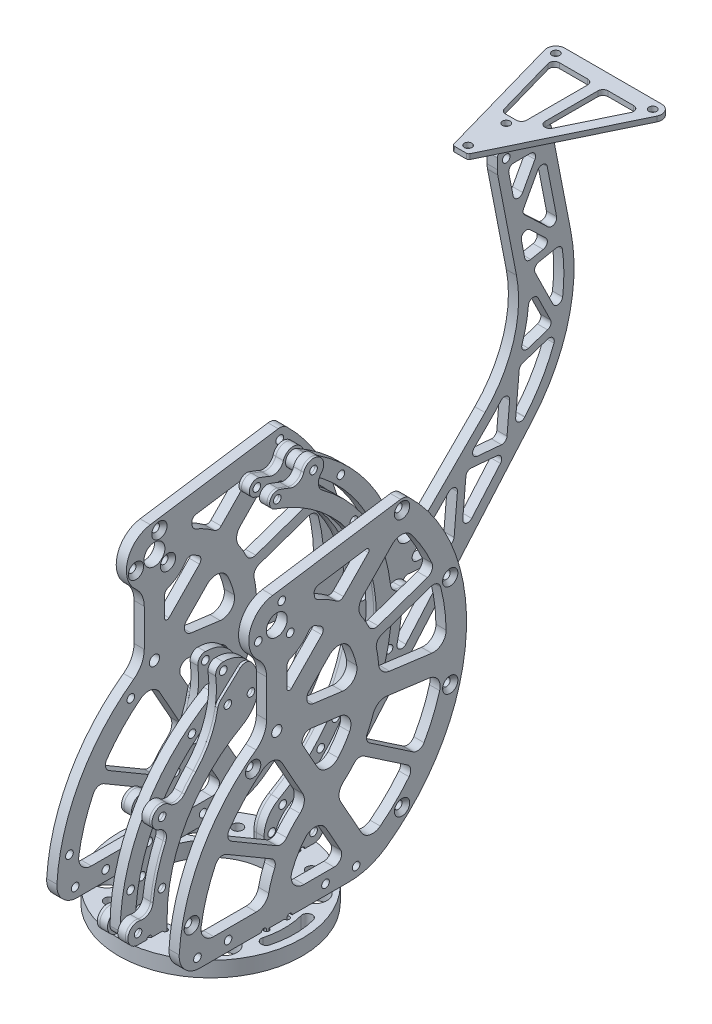
from build123d import *

# Parameters (mm, degrees)
EXTRUDE_START            = 2
EXTRUDE_1_OUTLINE_R      = 1.5
EXTRUDE_1_DEPTH          = 3
SKETCH_7_R               = 1.5
EXTRUDE_5_DEPTH          = 2
EXTRUDE_5_2_DEPTH        = 2
SKETCH_6_R               = 1.5
EXTRUDE_4_DEPTH          = 1
EXTRUDE_4_2_DEPTH        = 1
EXTRUDE_START_2          = 22
SKETCH_4_R               = 4.1
SKETCH_4_R_2             = 1.5
SKETCH_4_R_3             = 2
EXTRUDE_2_DEPTH          = 4
EXTRUDE_START_3          = -10
SKETCH_5_R               = 36
SKETCH_5_R_2             = 2
SKETCH_5_W               = 12.2
SKETCH_5_H               = 6
EXTRUDE_3_DEPTH          = 6
HOLE_WIZARD_1_AT_2_COUNT = 2
HOLE_WIZARD_1_AT_2_PITCH = 12.990381057
HOLE_WIZARD_1_AT_3_COUNT = 2
HOLE_WIZARD_1_AT_3_PITCH = 12.990381057
HOLE_WIZARD_2_AT_2_COUNT = 2
HOLE_WIZARD_2_AT_2_PITCH = 37.361097836
HOLE_WIZARD_2_AT_3_COUNT = 2
HOLE_WIZARD_2_AT_3_PITCH = 71.251165028
HOLE_WIZARD_2_AT_4_COUNT = 2
HOLE_WIZARD_2_AT_4_PITCH = 100.933141855
HOLE_WIZARD_2_AT_5_COUNT = 2
HOLE_WIZARD_2_AT_5_PITCH = 129.486576309
HOLE_WIZARD_2_AT_6_COUNT = 2
HOLE_WIZARD_2_AT_6_PITCH = 82.855445864
SKETCH_10_R              = 1
SKETCH_10_R_2            = 1.5
CUT_EXTRUDE_1_DEPTH      = 160.689953831
EXTRUDE_1_2_DEPTH        = 4
FILLET_1_R               = 1
FILLET_6_R               = 3
SKETCH_11_R              = 1
CUT_EXTRUDE_2_DEPTH      = 154.038823031
FILLET_2_R               = 1
FILLET_3_R               = 1
FILLET_4_R               = 1
FILLET_5_R               = 1
SKETCH_12_R              = 1
CUT_EXTRUDE_3_DEPTH      = 155.868988074
SKETCH_13_R              = 5
CUT_EXTRUDE_4_DEPTH      = 155.868988074
SKETCH_17_R              = 1.5
EXTRUDE_6_DEPTH          = 4
SKETCH_18_R              = 1.5
EXTRUDE_7_DEPTH          = 2
CUT_EXTRUDE_5_DEPTH      = 252.539261349
EXTRUDE_2_2_DEPTH        = 4
FILLET_7_R               = 2
FILLET_8_R               = 10
FILLET_9_R               = 1


# Read off the part's stored shape, not the designer's step: 凸台-拉伸1
with BuildPart() as part:
    # Extrude 1 outline → Extrude 1 (new body)
    # profile 1 of 2: a face of its own
    with BuildSketch(Plane(origin=(0, 0, 0), x_dir=(0, 0, -1), z_dir=(1, 0, 0)).offset(EXTRUDE_START)):
        with BuildLine():
            Line((29, -4), (34.421798998, -4))
            ThreePointArc((34.421798998, -4), (38.085911774, -1.604455534), (37.361252009, 2.71286122))
            ThreePointArc((37.361252009, 2.71286122), (36.321098701, 5.829124909), (37.965443128, 8.673267958))
            ThreePointArc((37.965443128, 8.673267958), (56.102866086, 28.586212787), (64.61549107, 54.140599871))
            ThreePointArc((64.61549107, 54.140599871), (66.293642355, 56.964927498), (69.520834816, 57.579945467))
            ThreePointArc((69.520834816, 57.579945467), (74.451666966, 61.470132032), (69.520834816, 65.360318597))
            ThreePointArc((69.520834816, 65.360318597), (66.293642355, 65.975336566), (64.61549107, 68.799664193))
            ThreePointArc((64.61549107, 68.799664193), (56.102866086, 94.354051277), (37.965443128, 114.266996106))
            ThreePointArc((37.965443128, 114.266996106), (36.321098701, 117.111139155), (37.361252009, 120.227402844))
            ThreePointArc((37.361252009, 120.227402844), (36.376148723, 126.430323827), (30.572760208, 124.028795367))
            ThreePointArc((30.572760208, 124.028795367), (28.459382166, 121.513511778), (25.175190488, 121.429230689))
            ThreePointArc((25.175190488, 121.429230689), (23.185358207, 122.226390086), (21.170333864, 122.957534742))
            ThreePointArc((21.170333864, 122.957534742), (17.357113609, 121.097601602), (19.21704675, 117.284381347))
            ThreePointArc((19.21704675, 117.284381347), (58.793922921, 66.742696861), (28.841251564, 9.965690276))
            ThreePointArc((28.841251564, 9.965690276), (24.567932157, 5.775707803), (23, 0))
            Line((23, 0), (23, -10))
            Line((23, -10), (29, -10))
            Line((29, -10), (29, -4))
        make_face()
        with Locations((26, 0)):
            Circle(EXTRUDE_1_OUTLINE_R, mode=Mode.SUBTRACT)
        with Locations((34.421798998, 0)):
            Circle(EXTRUDE_1_OUTLINE_R, mode=Mode.SUBTRACT)
        with Locations((30.307013858, 7.348145454)):
            Circle(EXTRUDE_1_OUTLINE_R, mode=Mode.SUBTRACT)
        with Locations((38.216133768, 12.610827494)):
            Circle(EXTRUDE_1_OUTLINE_R, mode=Mode.SUBTRACT)
        with Locations((45.228873497, 19.019531067)):
            Circle(EXTRUDE_1_OUTLINE_R, mode=Mode.SUBTRACT)
        with Locations((51.180745426, 26.423936549)):
            Circle(EXTRUDE_1_OUTLINE_R, mode=Mode.SUBTRACT)
        with Locations((55.932145163, 34.650369588)):
            Circle(EXTRUDE_1_OUTLINE_R, mode=Mode.SUBTRACT)
        with Locations((59.371626048, 43.505874725)):
            Circle(EXTRUDE_1_OUTLINE_R, mode=Mode.SUBTRACT)
        with Locations((61.418513186, 52.782741278)):
            Circle(EXTRUDE_1_OUTLINE_R, mode=Mode.SUBTRACT)
        with Locations((62.024795729, 62.263375301)):
            Circle(EXTRUDE_1_OUTLINE_R, mode=Mode.SUBTRACT)
        with Locations((70.451666966, 61.470132032)):
            Circle(EXTRUDE_1_OUTLINE_R, mode=Mode.SUBTRACT)
        with Locations((61.17625299, 71.725403373)):
            Circle(EXTRUDE_1_OUTLINE_R, mode=Mode.SUBTRACT)
        with Locations((58.892787999, 80.946888483)):
            Circle(EXTRUDE_1_OUTLINE_R, mode=Mode.SUBTRACT)
        with Locations((55.227960669, 89.711535688)):
            Circle(EXTRUDE_1_OUTLINE_R, mode=Mode.SUBTRACT)
        with Locations((44.128445409, 105.0635355)):
            Circle(EXTRUDE_1_OUTLINE_R, mode=Mode.SUBTRACT)
        with Locations((28.912981316, 116.349490916)):
            Circle(EXTRUDE_1_OUTLINE_R, mode=Mode.SUBTRACT)
        with Locations((20.193690307, 120.120958044)):
            Circle(EXTRUDE_1_OUTLINE_R, mode=Mode.SUBTRACT)
        with Locations((36.95410264, 111.290798609)):
            Circle(EXTRUDE_1_OUTLINE_R, mode=Mode.SUBTRACT)
        with Locations((34.421798998, 122.940264064)):
            Circle(EXTRUDE_1_OUTLINE_R, mode=Mode.SUBTRACT)
        with Locations((50.267731516, 97.813765428)):
            Circle(EXTRUDE_1_OUTLINE_R, mode=Mode.SUBTRACT)
    # profile 2 of 2: a face of its own
    with BuildSketch(Plane(origin=(0, 0, 0), x_dir=(0, 0, -1), z_dir=(1, 0, 0)).offset(EXTRUDE_START)):
        with BuildLine():
            Line((-23, -10), (-23, 0))
            ThreePointArc((-23, 0), (-15.117398916, 29.036715899), (6.366229721, 50.101377553))
            ThreePointArc((6.366229721, 50.101377553), (12.607752161, 64.759819665), (0, 74.5))
            ThreePointArc((0, 74.5), (-2.260798977, 73.47200101), (-2.972198578, 71.092525323))
            ThreePointArc((-2.972198578, 71.092525323), (-4.256369728, 56.258186856), (-11.803555646, 43.422818611))
            ThreePointArc((-11.803555646, 43.422818611), (-14.087312444, 40.855730262), (-16.228695422, 38.168730699))
            ThreePointArc((-16.228695422, 38.168730699), (-19.106207202, 36.588606081), (-22.197238795, 37.694224253))
            ThreePointArc((-22.197238795, 37.694224253), (-28.422164111, 36.835120058), (-26.130325085, 30.984032203))
            ThreePointArc((-26.130325085, 30.984032203), (-23.655417526, 28.827252098), (-23.628183774, 25.54455105))
            ThreePointArc((-23.628183774, 25.54455105), (-26.784748501, 16.6157495), (-28.576566086, 7.316459863))
            ThreePointArc((-28.576566086, 7.316459863), (-30.260038175, 4.498164354), (-33.485829596, 3.888953751))
            ThreePointArc((-33.485829596, 3.888953751), (-38.393940423, 0.471266907), (-34.421798998, -4))
            Line((-34.421798998, -4), (-29, -4))
            Line((-29, -4), (-29, -10))
            Line((-29, -10), (-23, -10))
        make_face()
        with Locations((-34.421798998, 0)):
            Circle(EXTRUDE_1_OUTLINE_R, mode=Mode.SUBTRACT)
        with Locations((-26, 0)):
            Circle(EXTRUDE_1_OUTLINE_R, mode=Mode.SUBTRACT)
        with Locations((-25.058956625, 10.622311644)):
            Circle(EXTRUDE_1_OUTLINE_R, mode=Mode.SUBTRACT)
        with Locations((-22.265139187, 20.913747472)):
            Circle(EXTRUDE_1_OUTLINE_R, mode=Mode.SUBTRACT)
        with Locations((-24.971265757, 34.812423702)):
            Circle(EXTRUDE_1_OUTLINE_R, mode=Mode.SUBTRACT)
        with Locations((-17.705572682, 30.553738166)):
            Circle(EXTRUDE_1_OUTLINE_R, mode=Mode.SUBTRACT)
        with Locations((-11.522283659, 39.242006357)):
            Circle(EXTRUDE_1_OUTLINE_R, mode=Mode.SUBTRACT)
        with Locations((-3.907876222, 46.70792001)):
            Circle(EXTRUDE_1_OUTLINE_R, mode=Mode.SUBTRACT)
        with Locations((4.900467427, 52.718922376)):
            Circle(EXTRUDE_1_OUTLINE_R, mode=Mode.SUBTRACT)
        with Locations((0.785682288, 60.06706783)):
            Circle(EXTRUDE_1_OUTLINE_R, mode=Mode.SUBTRACT)
        with Locations((0, 71.5)):
            Circle(EXTRUDE_1_OUTLINE_R, mode=Mode.SUBTRACT)
        with Locations((9.86186968, 59.642079002)):
            Circle(EXTRUDE_1_OUTLINE_R, mode=Mode.SUBTRACT)
        with Locations((7.711464906, 67.883521188)):
            Circle(EXTRUDE_1_OUTLINE_R, mode=Mode.SUBTRACT)
    extrude(amount=EXTRUDE_1_DEPTH)


with BuildPart() as body_2:
    # 草图7 → 凸台-拉伸5 (new, symmetric)
    with BuildSketch(Plane(origin=(0, 0, 0), x_dir=(0, 0, -1), z_dir=(1, 0, 0))):
        with BuildLine():
            ThreePointArc((-31.421798998, 0), (-22.383091991, 33.295401435), (2.251444582, 57.449523007))
            ThreePointArc((2.251444582, 57.449523007), (3.40322711, 61.532830124), (-0.680080007, 62.684612652))
            ThreePointArc((-0.680080007, 62.684612652), (-27.559439523, 36.329445969), (-37.421798998, 0))
            ThreePointArc((-37.421798998, 0), (-34.421798998, -3), (-31.421798998, 0))
        make_face()
        with Locations(Location((-9.276473273, 53.196823077, 0), (0, 0, 180))):
            Circle(SKETCH_7_R, mode=Mode.SUBTRACT)
        with Locations((-34.421798998, 0)):
            Circle(SKETCH_7_R, mode=Mode.SUBTRACT)
        with Locations((-24.971265757, 34.812423702)):
            Circle(SKETCH_7_R, mode=Mode.SUBTRACT)
        with Locations((0.785682288, 60.06706783)):
            Circle(SKETCH_7_R, mode=Mode.SUBTRACT)
        with Locations((-33.343650544, 12.1360963)):
            Circle(SKETCH_7_R, mode=Mode.SUBTRACT)
    extrude(amount=EXTRUDE_5_DEPTH, both=True)


with BuildPart() as body_3:
    # 草图7 → Extrude 5 2 (new, symmetric)
    with BuildSketch(Plane(origin=(0, 0, 0), x_dir=(0, 0, -1), z_dir=(1, 0, 0))):
        with BuildLine():
            ThreePointArc((35.887561292, -2.617544822), (73.451666966, 61.470132032), (35.887561292, 125.557808886))
            ThreePointArc((35.887561292, 125.557808886), (31.804254176, 124.406026358), (32.956036704, 120.322719242))
            ThreePointArc((32.956036704, 120.322719242), (67.451666966, 61.470132032), (32.956036704, 2.617544822))
            ThreePointArc((32.956036704, 2.617544822), (31.804254176, -1.465762294), (35.887561292, -2.617544822))
        make_face()
        with Locations((34.421798998, 0)):
            Circle(SKETCH_7_R, mode=Mode.SUBTRACT)
        with Locations((49.158545514, 11.003561104)):
            Circle(SKETCH_7_R, mode=Mode.SUBTRACT)
        with Locations((34.421798998, 122.940264064)):
            Circle(SKETCH_7_R, mode=Mode.SUBTRACT)
        with Locations((70.451666966, 61.470132032)):
            Circle(SKETCH_7_R, mode=Mode.SUBTRACT)
        with Locations((68.051084628, 43.235898862)):
            Circle(SKETCH_7_R, mode=Mode.SUBTRACT)
        with Locations(Location((49.158545514, 111.93670296, 0), (0, 0, 180))):
            Circle(SKETCH_7_R, mode=Mode.SUBTRACT)
        with Locations(Location((68.051084628, 79.704365202, 0), (0, 0, 180))):
            Circle(SKETCH_7_R, mode=Mode.SUBTRACT)
    extrude(amount=EXTRUDE_5_2_DEPTH, both=True)

    # 草图17 → 凸台-拉伸6 (add)
    with BuildSketch(Plane(origin=(2, 0, 0), x_dir=(0, 0, -1), z_dir=(1, 0, 0))):
        with BuildLine():
            Line((55.555214986, 13.420517383), (124.370061337, 92.984601531))
            ThreePointArc((124.370061337, 92.984601531), (138.386240804, 119.471430393), (139.404431197, 149.420865753))
            Line((139.404431197, 149.420865753), (131.5, 190))
            Line((131.5, 190), (110.5, 190))
            Line((110.5, 190), (110.5, 184))
            Line((110.5, 184), (118.046094868, 145.26046403))
            ThreePointArc((118.046094868, 145.26046403), (116.91258224, 123.508378339), (105.696074064, 104.836794927))
            Line((105.696074064, 104.836794927), (78.030852012, 77.171572875))
            ThreePointArc((78.030852012, 77.171572875), (74.12815577, 76.146956286), (71.318587246, 79.043022897))
            ThreePointArc((71.318587246, 79.043022897), (71.420016317, 44.314122898), (55.555214986, 13.420517383))
        make_face()
        with Locations((129.027986453, 187)):
            Circle(SKETCH_17_R, mode=Mode.SUBTRACT)
        with Locations((114.027986453, 187)):
            Circle(SKETCH_17_R, mode=Mode.SUBTRACT)
    extrude(amount=-EXTRUDE_6_DEPTH)

    # 草图19 → 切除-拉伸5 (cut, through all)
    with BuildSketch(Plane(origin=(2, 0, 0), x_dir=(0, 0, -1), z_dir=(1, 0, 0))):
        with BuildLine():
            Line((128.593563003, 184), (114.575180196, 184))
            Line((114.575180196, 184), (121.97230162, 146.025251937))
            ThreePointArc((121.97230162, 146.025251937), (120.738032314, 122.339647518), (108.524501188, 102.008367802))
            Line((108.524501188, 102.008367802), (73.261957732, 66.745824346))
            ThreePointArc((73.261957732, 66.745824346), (72.57305779, 50.143232058), (68.169908959, 34.120344235))
            Line((68.169908959, 34.120344235), (121.344658795, 95.601267246))
            ThreePointArc((121.344658795, 95.601267246), (134.52104028, 120.501102627), (135.478224445, 148.656077846))
            Line((135.478224445, 148.656077846), (128.593563003, 184))
        make_face()
    extrude(amount=-CUT_EXTRUDE_5_DEPTH, mode=Mode.SUBTRACT)

    # 草图20 → Extrude 2 2 (add)
    with BuildSketch(Plane(origin=(2, 0, 0), x_dir=(0, 0, -1), z_dir=(1, 0, 0))):
        Polygon((73.130919108, 65.251559015), (96.120510584, 63.235501786), (98.367919748, 88.8632557), (116.881703682, 87.239701494), (119.21413643, 113.837000036), (136.625911253, 119.619588427), (124.183359919, 144.927752589), (138.619108498, 147.739699752), (120.141018174, 165.307084029), (129.91148238, 183.283698026), (127.275643627, 184.716301974), (116.406463642, 164.718167908), (132.337340393, 149.57245594), (119.76124332, 147.122751285), (132.416169307, 121.382616827), (116.397812592, 116.062793632), (114.155250268, 90.490309403), (95.641466333, 92.113863609), (93.39405717, 66.486109695), (73.392996355, 68.240089677), align=None)
    extrude(amount=-EXTRUDE_2_2_DEPTH)

    # 圆角7
    fillet_7_edges = [body_3.edges().sort_by_distance(p)[0] for p in [
        (0, 90.802407524, -117.194132864),
        (0, 87.465403925, -114.307963905),
        (0, 66.798207816, -96.432939766),
        (0, 63.461204217, -93.546770807),
        (0, 147.180322524, -135.747422595),
        (0, 122.765262604, -135.079366344),
        (0, 118.757275865, -134.029428304),
        (0, 181.687612222, -129.043994252),
        (0, 151.19618606, -134.983435412),
        (0, 184, -126.886326551),
        (0, 147.497579469, -121.685506155),
        (0, 162.472517755, -118.768529941),
        (0, 111.641831207, -116.010119176),
        (0, 116.821437804, -118.682142827),
        (0, 141.219931038, -122.66331648),
        (0, 68.130180788, -74.646314174),
        (0, 88.838063821, -95.354197207),
        (0, 91.872916097, -98.389049483),
        (0, 66.486109695, -93.39405717),
        (0, 121.382616827, -132.416169307),
        (0, 90.490309403, -114.155250268),
        (0, 149.57245594, -132.337340393),
        (0, 167.325013747, -117.823309659),
        (0, 165.307084029, -120.141018174),
        (0, 144.927752589, -124.183359919),
        (0, 65.231884133, -73.355276574),
        (0, 88.8632557, -98.367919748),
        (0, 113.837000036, -119.21413643),
        (0, 34.120344235, -68.169908959),
        (0, 184, -114.575180196),
    ]]
    fillet(fillet_7_edges, radius=FILLET_7_R)

    # 圆角8
    fillet_8_edges = [body_3.edges().sort_by_distance(p)[0] for p in [
        (0, 184, -110.5),
    ]]
    fillet(fillet_8_edges, radius=FILLET_8_R)

    # 圆角9
    fillet_9_edges = [body_3.edges().sort_by_distance(p)[0] for p in [
        (0, 190, -110.5),
        (0, 190, -131.5),
    ]]
    fillet(fillet_9_edges, radius=FILLET_9_R)


with BuildPart() as body_4:
    # 草图6 → 凸台-拉伸4 (new body)
    with BuildSketch(Plane(origin=(5, 0, 0), x_dir=(0, 0, -1), z_dir=(1, 0, 0))):
        with BuildLine():
            Line((5.666901275, 70.078916269), (-1.940402553, 62.994261271))
            ThreePointArc((-1.940402553, 62.994261271), (-2.731673408, 61.97185362), (-3.155506565, 60.750464073))
            ThreePointArc((-3.155506565, 60.750464073), (-6.208965462, 51.452515138), (-11.803555646, 43.422818611))
            ThreePointArc((-11.803555646, 43.422818611), (-14.087312444, 40.855730262), (-16.228695422, 38.168730699))
            ThreePointArc((-16.228695422, 38.168730699), (-19.106207202, 36.588606081), (-22.197238795, 37.694224253))
            ThreePointArc((-22.197238795, 37.694224253), (-28.422164111, 36.835120058), (-26.130325085, 30.984032203))
            ThreePointArc((-26.130325085, 30.984032203), (-23.655417526, 28.827252098), (-23.628183774, 25.54455105))
            ThreePointArc((-23.628183774, 25.54455105), (-26.784748501, 16.615749499), (-28.576566086, 7.316459863))
            ThreePointArc((-28.576566086, 7.316459863), (-30.260038175, 4.498164354), (-33.485829596, 3.888953751))
            ThreePointArc((-33.485829596, 3.888953751), (-38.393940423, 0.471266907), (-34.421798998, -4))
            Line((-34.421798998, -4), (-29, -4))
            Line((-29, -4), (-29, -10))
            Line((-29, -10), (-23, -10))
            Line((-23, -10), (-23, 0))
            ThreePointArc((-23, 0), (-15.117398916, 29.036715899), (6.366229721, 50.101377553))
            ThreePointArc((6.366229721, 50.101377553), (12.811620278, 59.095296223), (10.01801518, 69.801808401))
            ThreePointArc((10.01801518, 69.801808401), (7.902138562, 70.877455649), (5.666901275, 70.078916269))
        make_face()
        with Locations((0.785682288, 60.06706783)):
            Circle(SKETCH_6_R, mode=Mode.SUBTRACT)
        with Locations((-24.971265757, 34.812423702)):
            Circle(SKETCH_6_R, mode=Mode.SUBTRACT)
        with Locations((-34.421798998, 0)):
            Circle(SKETCH_6_R, mode=Mode.SUBTRACT)
        with Locations((-25.058956625, 10.622311644)):
            Circle(SKETCH_6_R, mode=Mode.SUBTRACT)
        with Locations((9.86186968, 59.642079002)):
            Circle(SKETCH_6_R, mode=Mode.SUBTRACT)
    extrude(amount=EXTRUDE_4_DEPTH)


with BuildPart() as body_5:
    # 草图6 → Extrude 4 2 (new body)
    with BuildSketch(Plane(origin=(5, 0, 0), x_dir=(0, 0, -1), z_dir=(1, 0, 0))):
        with BuildLine():
            Line((23, 0), (23, -10))
            Line((23, -10), (29, -10))
            Line((29, -10), (29, -4))
            Line((29, -4), (34.421798998, -4))
            ThreePointArc((34.421798998, -4), (38.085911774, -1.604455534), (37.361252009, 2.71286122))
            ThreePointArc((37.361252009, 2.71286122), (36.321098701, 5.829124908), (37.965443128, 8.673267958))
            ThreePointArc((37.965443128, 8.673267958), (56.102866086, 28.586212787), (64.61549107, 54.140599871))
            ThreePointArc((64.61549107, 54.140599871), (66.293642355, 56.964927498), (69.520834816, 57.579945467))
            ThreePointArc((69.520834816, 57.579945467), (74.451666966, 61.470132032), (69.520834816, 65.360318597))
            ThreePointArc((69.520834816, 65.360318597), (66.293642355, 65.975336566), (64.61549107, 68.799664193))
            ThreePointArc((64.61549107, 68.799664193), (56.102866086, 94.354051277), (37.965443128, 114.266996106))
            ThreePointArc((37.965443128, 114.266996106), (36.321098701, 117.111139156), (37.361252009, 120.227402844))
            ThreePointArc((37.361252009, 120.227402844), (36.376148723, 126.430323827), (30.572760208, 124.028795367))
            ThreePointArc((30.572760208, 124.028795367), (28.459382166, 121.513511778), (25.175190488, 121.429230689))
            ThreePointArc((25.175190488, 121.429230689), (23.185358207, 122.226390086), (21.170333864, 122.957534742))
            ThreePointArc((21.170333864, 122.957534742), (17.357113609, 121.097601602), (19.21704675, 117.284381347))
            ThreePointArc((19.21704675, 117.284381347), (58.793922921, 66.742696861), (28.841251564, 9.965690276))
            ThreePointArc((28.841251564, 9.965690276), (24.567932157, 5.775707803), (23, 0))
        make_face()
        with Locations((34.421798998, 0)):
            Circle(SKETCH_6_R, mode=Mode.SUBTRACT)
        with Locations((34.421798998, 122.940264064)):
            Circle(SKETCH_6_R, mode=Mode.SUBTRACT)
        with Locations((70.451666966, 61.470132032)):
            Circle(SKETCH_6_R, mode=Mode.SUBTRACT)
        with Locations((51.180745426, 26.423936549)):
            Circle(SKETCH_6_R, mode=Mode.SUBTRACT)
        with Locations((50.267731516, 97.813765428)):
            Circle(SKETCH_6_R, mode=Mode.SUBTRACT)
        with Locations((20.193690307, 120.120958044)):
            Circle(SKETCH_6_R, mode=Mode.SUBTRACT)
    extrude(amount=EXTRUDE_4_2_DEPTH)


with BuildPart() as body_6:
    # 草图4 → Extrude 2 (new body)
    with BuildSketch(Plane(origin=(0, 0, 0), x_dir=(0, 0, -1), z_dir=(1, 0, 0)).offset(EXTRUDE_START_2)):
        with BuildLine():
            Line((-4, -4), (-4, -10))
            Line((-4, -10), (4, -10))
            Line((4, -10), (4, -4))
            Line((4, -4), (28.41893346, -4))
            ThreePointArc((28.41893346, -4), (35.952659525, -2.837847461), (42.785958479, 0.540562273))
            ThreePointArc((42.785958479, 0.540562273), (74.213384595, 55.518303658), (51.949596323, 114.802018891))
            ThreePointArc((51.949596323, 114.802018891), (50.38578598, 115.743785943), (48.566369984, 115.892626132))
            Line((48.566369984, 115.892626132), (-1.628482709, 108.378788722))
            ThreePointArc((-1.628482709, 108.378788722), (-10.538891795, 100.651469455), (-7.333333333, 89.301084083))
            ThreePointArc((-7.333333333, 89.301084083), (-4.871290708, 85.930007062), (-4, 81.847524158))
            Line((-4, 81.847524158), (-4, 67.218978798))
            ThreePointArc((-4, 67.218978798), (-5.099166973, 62.660999923), (-8.155034285, 59.105017017))
            ThreePointArc((-8.155034285, 59.105017017), (-29.359643582, 35.186891756), (-38.283072025, 4.493495133))
            ThreePointArc((-38.283072025, 4.493495133), (-36.12702794, -1.479600302), (-30.298307623, -4))
            Line((-30.298307623, -4), (-4, -4))
        make_face()
        with Locations((0, 97.5)):
            Circle(SKETCH_4_R, mode=Mode.SUBTRACT)
        with Locations((1.941142838, 104.744443697)):
            Circle(SKETCH_4_R_2, mode=Mode.SUBTRACT)
        with Locations((5.303300859, 92.196699141)):
            Circle(SKETCH_4_R_2, mode=Mode.SUBTRACT)
        with Locations((-7.244443697, 95.558857162)):
            Circle(SKETCH_4_R_2, mode=Mode.SUBTRACT)
        with Locations((0, 61.470132032)):
            Circle(SKETCH_4_R_3, mode=Mode.SUBTRACT)
        with Locations((-33.343650544, 12.1360963)):
            Circle(SKETCH_4_R_2, mode=Mode.SUBTRACT)
        with Locations((-9.276473273, 53.196823077)):
            Circle(SKETCH_4_R_2, mode=Mode.SUBTRACT)
        with Locations((49.158545514, 11.003561104)):
            Circle(SKETCH_4_R_2, mode=Mode.SUBTRACT)
        with Locations((68.051084628, 43.235898862)):
            Circle(SKETCH_4_R_2, mode=Mode.SUBTRACT)
        with Locations((68.051084628, 79.704365202)):
            Circle(SKETCH_4_R_2, mode=Mode.SUBTRACT)
        with Locations((49.158545514, 111.93670296)):
            Circle(SKETCH_4_R_2, mode=Mode.SUBTRACT)
        with BuildLine():
            Line((-24.741164257, 4), (-8.057050189, 4))
            ThreePointArc((-8.057050189, 4), (-4.909172262, 5.115303801), (-3.165630422, 7.963654177))
            ThreePointArc((-3.165630422, 7.963654177), (1.274368266, 19.428908207), (9.108646153, 28.904652416))
            ThreePointArc((9.108646153, 28.904652416), (10.742001784, 31.817586915), (10.177107424, 35.109080858))
            Line((10.177107424, 35.109080858), (2.025458986, 49.666219656))
            ThreePointArc((2.025458986, 49.666219656), (-1.346485427, 52.124165239), (-5.408364435, 51.168840929))
            ThreePointArc((-5.408364435, 51.168840929), (-21.520367403, 32.789727346), (-29.684296458, 9.751960135))
            ThreePointArc((-29.684296458, 9.751960135), (-28.533248161, 5.741150561), (-24.741164257, 4))
        make_face(mode=Mode.SUBTRACT)
        with BuildLine():
            Line((10.64643645, 4), (22.479181706, 4))
            ThreePointArc((22.479181706, 4), (25.067355472, 5.482977733), (25.096726528, 8.465762294))
            Line((25.096726528, 8.465762294), (19.315395918, 18.790009321))
            ThreePointArc((19.315395918, 18.790009321), (15.422086729, 21.325002444), (11.123631591, 19.562240407))
            ThreePointArc((11.123631591, 19.562240407), (8.176164975, 15.383515495), (5.970260199, 10.770134364))
            ThreePointArc((5.970260199, 10.770134364), (6.532395139, 6.158404658), (10.64643645, 4))
        make_face(mode=Mode.SUBTRACT)
        with BuildLine():
            Line((10.312098835, 51.241747133), (15.942942522, 41.186238271))
            ThreePointArc((15.942942522, 41.186238271), (19.780462149, 38.656820134), (24.061643088, 40.328945359))
            ThreePointArc((24.061643088, 40.328945359), (26.514477204, 43.500854343), (28.551794472, 46.954365622))
            ThreePointArc((28.551794472, 46.954365622), (28.518635015, 51.550387103), (24.747367649, 54.17756343))
            Line((24.747367649, 54.17756343), (13.321222234, 55.681844012))
            ThreePointArc((13.321222234, 55.681844012), (10.446229374, 54.390558297), (10.312098835, 51.241747133))
        make_face(mode=Mode.SUBTRACT)
        with BuildLine():
            Line((25.04717182, 24.927989333), (33.190820627, 10.385136201))
            ThreePointArc((33.190820627, 10.385136201), (36.553015368, 7.929171447), (40.608918247, 8.870324034))
            ThreePointArc((40.608918247, 8.870324034), (55.009006303, 24.189664383), (63.902434489, 43.240954624))
            ThreePointArc((63.902434489, 43.240954624), (63.27380052, 47.356891418), (59.746876475, 49.569790679))
            Line((59.746876475, 49.569790679), (43.221730219, 51.745367456))
            ThreePointArc((43.221730219, 51.745367456), (39.939113212, 51.040574618), (37.842336647, 48.418393197))
            ThreePointArc((37.842336647, 48.418393197), (33.136915293, 39.012724025), (26.144164384, 31.157214023))
            ThreePointArc((26.144164384, 31.157214023), (24.485520263, 28.238103363), (25.04717182, 24.927989333))
        make_face(mode=Mode.SUBTRACT)
        with BuildLine():
            Line((12.6080234, 68.681025593), (20.649557943, 76.936531714))
            ThreePointArc((20.649557943, 76.936531714), (25.010978847, 78.386538852), (28.713504229, 75.66333875))
            ThreePointArc((28.713504229, 75.66333875), (30.261809594, 71.96466976), (31.335872469, 68.101537514))
            ThreePointArc((31.335872469, 68.101537514), (30.114305002, 63.670703967), (25.791577187, 62.109122321))
            Line((25.791577187, 62.109122321), (14.365431772, 63.613402903))
            ThreePointArc((14.365431772, 63.613402903), (11.922611253, 65.60479203), (12.6080234, 68.681025593))
        make_face(mode=Mode.SUBTRACT)
        with BuildLine():
            Line((60.791086013, 57.50134957), (44.265939757, 59.676926347))
            ThreePointArc((44.265939757, 59.676926347), (41.277589021, 61.207307751), (39.930928877, 64.282826215))
            ThreePointArc((39.930928877, 64.282826215), (37.820207181, 74.585857643), (33.098884078, 83.983554746))
            ThreePointArc((33.098884078, 83.983554746), (32.252278319, 87.23248781), (33.651512616, 90.28444632))
            Line((33.651512616, 90.28444632), (45.281640679, 102.22403234))
            ThreePointArc((45.281640679, 102.22403234), (49.164921865, 103.726112092), (52.839034991, 101.767283591))
            ThreePointArc((52.839034991, 101.767283591), (62.783514904, 83.242920067), (66.443070125, 62.538998208))
            ThreePointArc((66.443070125, 62.538998208), (64.770573508, 58.726011003), (60.791086013, 57.50134957))
        make_face(mode=Mode.SUBTRACT)
    extrude(amount=EXTRUDE_2_DEPTH)

    # 草图9 → 孔1 (revolve, cut)
    with BuildSketch(Plane(origin=(22, 104.744443697, -1.941142838), x_dir=(0, 0, 1), z_dir=(0, 1, 0))):
        Polygon((0, 0), (0, 14), (1.5, 14), (1.5, 1.5), (3, 0), align=None)
    hole_wizard_1 = revolve(axis=Axis((15.554685906, 104.744443697, -1.941142838), (1, 0, 0)), mode=Mode.SUBTRACT)

    # 孔1 at 2: 孔1 ×2
    with Locations(*[Vector(0, -0.9659258262890684, -0.25881904510252013) * (i * HOLE_WIZARD_1_AT_2_PITCH) for i in range(1, HOLE_WIZARD_1_AT_2_COUNT)]):
        add(hole_wizard_1, mode=Mode.SUBTRACT)

    # 孔1 at 3: 孔1 ×2
    with Locations(*[Vector(0, -0.7071067811865471, 0.7071067811865479) * (i * HOLE_WIZARD_1_AT_3_PITCH) for i in range(1, HOLE_WIZARD_1_AT_3_COUNT)]):
        add(hole_wizard_1, mode=Mode.SUBTRACT)

    # 草图16 → 孔2 (revolve, cut)
    with BuildSketch(Plane(origin=(26, 111.93670296, -49.158545514), x_dir=(0, 0, -1), z_dir=(0, 1, 0))):
        Polygon((0, 0), (0, 62), (1.5, 62), (1.5, 1.5), (3, 0), align=None)
    hole_wizard_2 = revolve(axis=Axis((32.445314094, 111.93670296, -49.158545514), (-1, 0, 0)), mode=Mode.SUBTRACT)

    # 孔2 at 2: 孔2 ×2
    with Locations(*[Vector(0, -0.8627245885449095, -0.505674089033655) * (i * HOLE_WIZARD_2_AT_2_PITCH) for i in range(1, HOLE_WIZARD_2_AT_2_COUNT)]):
        add(hole_wizard_2, mode=Mode.SUBTRACT)

    # 孔2 at 3: 孔2 ×2
    with Locations(*[Vector(0, -0.9642060459069158, -0.2651541080891461) * (i * HOLE_WIZARD_2_AT_3_PITCH) for i in range(1, HOLE_WIZARD_2_AT_3_COUNT)]):
        add(hole_wizard_2, mode=Mode.SUBTRACT)

    # 孔2 at 4: 孔2 ×2
    with Locations(*[(0, -i * HOLE_WIZARD_2_AT_4_PITCH, 0) for i in range(1, HOLE_WIZARD_2_AT_4_COUNT)]):
        add(hole_wizard_2, mode=Mode.SUBTRACT)

    # 孔2 at 5: 孔2 ×2
    with Locations(*[Vector(0, -0.770740948637596, 0.6371486405017424) * (i * HOLE_WIZARD_2_AT_5_PITCH) for i in range(1, HOLE_WIZARD_2_AT_5_COUNT)]):
        add(hole_wizard_2, mode=Mode.SUBTRACT)

    # 孔2 at 6: 孔2 ×2
    with Locations(*[Vector(0, -0.708944104638341, 0.7052646712394864) * (i * HOLE_WIZARD_2_AT_6_PITCH) for i in range(1, HOLE_WIZARD_2_AT_6_COUNT)]):
        add(hole_wizard_2, mode=Mode.SUBTRACT)

    # 草图10 → 切除-拉伸1 (cut, through all)
    with BuildSketch(Plane(origin=(26, 0, 0), x_dir=(0, 0, -1), z_dir=(1, 0, 0))):
        with Locations((-5, -4)):
            Circle(SKETCH_10_R)
        with Locations((5, -4)):
            Circle(SKETCH_10_R)
        with Locations((-31.11473671, 0)):
            Circle(SKETCH_10_R_2)
        with Locations((-19.11473671, 0)):
            Circle(SKETCH_10_R_2)
        with Locations(Location((19.11473671, 0, 0), (0, 0, 180))):
            Circle(SKETCH_10_R_2)
        with Locations(Location((31.11473671, 0, 0), (0, 0, 180))):
            Circle(SKETCH_10_R_2)
        with BuildLine():
            Line((16.339428956, 102.979330378), (35.073608105, 105.78371307))
            ThreePointArc((35.073608105, 105.78371307), (36.111603049, 105.250788311), (35.93798097, 104.096969575))
            Line((35.93798097, 104.096969575), (26.161191482, 94.060036322))
            ThreePointArc((26.161191482, 94.060036322), (24.897833112, 93.462740197), (23.551821111, 93.838357993))
            ThreePointArc((23.551821111, 93.838357993), (19.901635264, 96.202181257), (16.016568994, 98.156094568))
            ThreePointArc((16.016568994, 98.156094568), (15.228328252, 98.773804815), (14.838352864, 99.696197689))
            ThreePointArc((14.838352864, 99.696197689), (14.765131358, 100.144030252), (14.678397107, 100.589443052))
            ThreePointArc((14.678397107, 100.589443052), (14.993223741, 102.142803752), (16.339428956, 102.979330378))
        make_face()
        with BuildLine():
            Line((17.665905116, 85.338704813), (5.716328983, 73.071170752))
            ThreePointArc((5.716328983, 73.071170752), (4.623389447, 72.842561773), (4, 73.768933454))
            Line((4, 73.768933454), (4, 81.594026279))
            ThreePointArc((4, 81.594026279), (4.355043358, 82.731619197), (5.294117647, 83.465317305))
            ThreePointArc((5.294117647, 83.465317305), (9.30163825, 85.732267599), (12.432767384, 89.107962395))
            ThreePointArc((12.432767384, 89.107962395), (13.606667559, 89.929625884), (15.028900049, 89.755191787))
            ThreePointArc((15.028900049, 89.755191787), (16.185483079, 89.109643235), (17.314387246, 88.416828237))
            ThreePointArc((17.314387246, 88.416828237), (18.220331982, 86.961152836), (17.665905116, 85.338704813))
        make_face()
    extrude(amount=-CUT_EXTRUDE_1_DEPTH, mode=Mode.SUBTRACT)

    # 草图14 → Extrude 1 2 (add)
    with BuildSketch(Plane(origin=(26, 0, 0), x_dir=(0, 0, -1), z_dir=(1, 0, 0))):
        Polygon((62.128217934, 85.132519463), (37.16491021, 76.47545704), (34.330511115, 75.492511584), (35.641105057, 71.71331279), (38.475504152, 72.696258246), (63.438811875, 81.35332067), align=None)
        Polygon((56.131038882, 25.845273906), (34.258947873, 40.668333548), (31.775533589, 42.351382417), (29.53146843, 39.040163372), (32.014882714, 37.357114503), (53.886973723, 22.534054861), align=None)
        Polygon((-22.531715581, 31.064278169), (0.263020088, 17.70345903), (2.851193854, 16.186436763), (4.87389021, 19.637335117), (2.285716444, 21.154357384), (-20.509019225, 34.515176523), align=None)
    extrude(amount=-EXTRUDE_1_2_DEPTH)

    # 圆角1
    fillet_1_edges = [body_6.edges().sort_by_distance(p)[0] for p in [
        (24, -10, -4),
        (24, -10, 4),
    ]]
    fillet(fillet_1_edges, radius=FILLET_1_R)

    # 圆角6
    fillet_6_edges = [body_6.edges().sort_by_distance(p)[0] for p in [
        (24, 81.343457179, -63.410369737),
        (24, 85.122655972, -62.099775795),
        (24, 72.679877817, -38.428269919),
        (24, 76.45907661, -37.117675977),
        (24, 37.385161902, -31.973497516),
        (24, 40.696380947, -34.217562675),
        (24, 22.550943629, -53.862053587),
        (24, 25.862162674, -56.106118746),
        (24, 34.499576081, 20.482403494),
        (24, 31.048677727, 22.50509985),
        (24, 21.12801728, -2.330654985),
        (24, 17.677118926, -0.307958629),
    ]]
    fillet(fillet_6_edges, radius=FILLET_6_R)


with BuildPart() as body_7:
    # 草图5 → 凸台-拉伸3 (new body)
    with BuildSketch(Plane(origin=(0, 0, 6), x_dir=(1, 0, 0), z_dir=(0, 1, 0)).offset(EXTRUDE_START_3)):
        with Locations(Location((0, 6, 0), (0, 0, 270))):
            Circle(SKETCH_5_R)
        with Locations(Location((14.5, 31.11473671, 0), (0, 0, 270))):
            Circle(SKETCH_5_R_2, mode=Mode.SUBTRACT)
        with Locations(Location((-14.5, 31.11473671, 0), (0, 0, 270))):
            Circle(SKETCH_5_R_2, mode=Mode.SUBTRACT)
        with Locations(Location((14.5, -19.11473671, 0), (0, 0, 270))):
            Circle(SKETCH_5_R_2, mode=Mode.SUBTRACT)
        with Locations(Location((-14.5, -19.11473671, 0), (0, 0, 270))):
            Circle(SKETCH_5_R_2, mode=Mode.SUBTRACT)
        with Locations((0, -20)):
            Rectangle(SKETCH_5_W, SKETCH_5_H, mode=Mode.SUBTRACT)
        with BuildLine():
            Line((22, 3), (22, 2))
            Line((22, 2), (26, 2))
            Line((26, 2), (26, 10))
            Line((26, 10), (22, 10))
            Line((22, 10), (22, 9))
            ThreePointArc((22, 9), (21.904684261, 8.897964168), (21.796401028, 8.986118252))
            ThreePointArc((21.796401028, 8.986118252), (0, 28), (-21.796401028, 8.986118252))
            ThreePointArc((-21.796401028, 8.986118252), (-21.904684261, 8.897964168), (-22, 9))
            Line((-22, 9), (-22, 10))
            Line((-22, 10), (-26, 10))
            Line((-26, 10), (-26, 2))
            Line((-26, 2), (-22, 2))
            Line((-22, 2), (-22, 3))
            ThreePointArc((-22, 3), (-21.904684261, 3.102035832), (-21.796401028, 3.013881748))
            ThreePointArc((-21.796401028, 3.013881748), (0, -16), (21.796401028, 3.013881748))
            ThreePointArc((21.796401028, 3.013881748), (21.904684261, 3.102035832), (22, 3))
        make_face(mode=Mode.SUBTRACT)
        with Locations((0, 32)):
            Rectangle(SKETCH_5_W, SKETCH_5_H, mode=Mode.SUBTRACT)
        with BuildLine():
            ThreePointArc((31.875552268, -2.541028488), (33, 6), (31.875552268, 14.541028488))
            ThreePointArc((31.875552268, 14.541028488), (29.426062525, 15.955242051), (28.011848962, 13.505752308))
            ThreePointArc((28.011848962, 13.505752308), (29, 6), (28.011848962, -1.505752308))
            ThreePointArc((28.011848962, -1.505752308), (29.426062525, -3.955242051), (31.875552268, -2.541028488))
        make_face(mode=Mode.SUBTRACT)
        with BuildLine():
            ThreePointArc((-31.875552268, -2.541028488), (-33, 6), (-31.875552268, 14.541028488))
            ThreePointArc((-31.875552268, 14.541028488), (-29.426062525, 15.955242051), (-28.011848962, 13.505752308))
            ThreePointArc((-28.011848962, 13.505752308), (-29, 6), (-28.011848962, -1.505752308))
            ThreePointArc((-28.011848962, -1.505752308), (-29.426062525, -3.955242051), (-31.875552268, -2.541028488))
        make_face(mode=Mode.SUBTRACT)
    extrude(amount=EXTRUDE_3_DEPTH)

    # 草图12 → 切除-拉伸3 (cut, through all)
    with BuildSketch(Plane(origin=(0, -4, 0), x_dir=(1, 0, 0), z_dir=(0, 1, 0))):
        with Locations((6.1, -24)):
            Circle(SKETCH_12_R)
        with Locations((5.1, -29)):
            Circle(SKETCH_12_R)
        with Locations((23, -4)):
            Circle(SKETCH_12_R)
        with Locations((26, -4)):
            Circle(SKETCH_12_R)
        with Locations((-26, -4)):
            Circle(SKETCH_12_R)
        with Locations((-23, -4)):
            Circle(SKETCH_12_R)
        with Locations((-5.1, -29)):
            Circle(SKETCH_12_R)
        with Locations((-6.1, -24)):
            Circle(SKETCH_12_R)
        with Locations((-6.1, 24)):
            Circle(SKETCH_12_R)
        with Locations((-5.1, 29)):
            Circle(SKETCH_12_R)
        with Locations((-23, 4)):
            Circle(SKETCH_12_R)
        with Locations((-26, 4)):
            Circle(SKETCH_12_R)
        with Locations((26, 4)):
            Circle(SKETCH_12_R)
        with Locations((23, 4)):
            Circle(SKETCH_12_R)
        with Locations((5.1, 29)):
            Circle(SKETCH_12_R)
        with Locations((6.1, 24)):
            Circle(SKETCH_12_R)
    extrude(amount=-CUT_EXTRUDE_3_DEPTH, mode=Mode.SUBTRACT)

    # 草图13 → 切除-拉伸4 (cut, through all)
    with BuildSketch(Plane(origin=(0, -4, 0), x_dir=(1, 0, 0), z_dir=(0, 1, 0))):
        with Locations(Location((23.007246868, 17.654081441, 0), (0, 0, 270))):
            Circle(SKETCH_13_R)
        with Locations(Location((23.007246868, -17.654081441, 0), (0, 0, 90))):
            Circle(SKETCH_13_R)
        with Locations(Location((-23.007246868, -17.654081441, 0), (0, 0, 270))):
            Circle(SKETCH_13_R)
        with Locations(Location((-23.007246868, 17.654081441, 0), (0, 0, 90))):
            Circle(SKETCH_13_R)
    extrude(amount=-CUT_EXTRUDE_4_DEPTH, mode=Mode.SUBTRACT)


with BuildPart() as cut_extrude_2_tool:
    # 草图11 → 切除-拉伸2 (new, through all)
    with BuildSketch(Plane(origin=(6, 0, 0), x_dir=(0, 0, -1), z_dir=(1, 0, 0))):
        with Locations((-30, -4)):
            Circle(SKETCH_11_R)
        with Locations((30, -4)):
            Circle(SKETCH_11_R)
    extrude(amount=-CUT_EXTRUDE_2_DEPTH)


with BuildPart() as part_1:
    add(part.part)

    # 切除-拉伸2: cut by cut_extrude_2_tool
    add(cut_extrude_2_tool.part, mode=Mode.SUBTRACT)

    # 圆角3
    fillet_3_edges = [part_1.edges().sort_by_distance(p)[0] for p in [
        (3.5, -10, 23),
        (3.5, -10, 29),
    ]]
    fillet(fillet_3_edges, radius=FILLET_3_R)

    # 圆角5
    fillet_5_edges = [part_1.edges().sort_by_distance(p)[0] for p in [
        (3.5, -10, -29),
        (3.5, -10, -23),
    ]]
    fillet(fillet_5_edges, radius=FILLET_5_R)


with BuildPart() as body_4_1:
    add(body_4.part)

    # 切除-拉伸2: cut by cut_extrude_2_tool
    add(cut_extrude_2_tool.part, mode=Mode.SUBTRACT)

    # 圆角2
    fillet_2_edges = [body_4_1.edges().sort_by_distance(p)[0] for p in [
        (5.5, -10, 23),
        (5.5, -10, 29),
    ]]
    fillet(fillet_2_edges, radius=FILLET_2_R)


with BuildPart() as body_5_1:
    add(body_5.part)

    # 切除-拉伸2: cut by cut_extrude_2_tool
    add(cut_extrude_2_tool.part, mode=Mode.SUBTRACT)

    # 圆角4
    fillet_4_edges = [body_5_1.edges().sort_by_distance(p)[0] for p in [
        (5.5, -10, -29),
        (5.5, -10, -23),
    ]]
    fillet(fillet_4_edges, radius=FILLET_4_R)


with BuildPart() as body_8:
    # 镜向1: mirrored copy
    add(part_1.part.mirror(Plane(origin=(0, 0, 0), x_dir=(0, 0, 1), z_dir=(1, 0, 0))))


with BuildPart() as body_9:
    # Mirror 1 2: mirrored copy
    add(body_4_1.part.mirror(Plane(origin=(0, 0, 0), x_dir=(0, 0, 1), z_dir=(1, 0, 0))))


with BuildPart() as body_10:
    # Mirror 1 3: mirrored copy
    add(body_5_1.part.mirror(Plane(origin=(0, 0, 0), x_dir=(0, 0, 1), z_dir=(1, 0, 0))))


with BuildPart() as body_11:
    # Mirror 1 4: mirrored copy
    add(body_6.part.mirror(Plane(origin=(0, 0, 0), x_dir=(0, 0, 1), z_dir=(1, 0, 0))))


with BuildPart() as body_12:
    # 草图18 → 凸台-拉伸7 (new body)
    with BuildSketch(Plane(origin=(0, 190, 0), x_dir=(1, 0, 0), z_dir=(0, 1, 0))):
        with BuildLine():
            Line((19, 158), (-19, 158))
            ThreePointArc((-19, 158), (-21.792788075, 156.609581657), (-22.366636854, 153.543048439))
            Line((-22.366636854, 153.543048439), (-8.206528633, 103.726585268))
            ThreePointArc((-8.206528633, 103.726585268), (-7.847370005, 103.20206055), (-7.244632389, 103))
            Line((-7.244632389, 103), (-2.62739557, 103))
            ThreePointArc((-2.62739557, 103), (-2.095938178, 103.152914975), (-1.727016373, 103.56489392))
            Line((-1.727016373, 103.56489392), (22.15132719, 152.977128719))
            ThreePointArc((22.15132719, 152.977128719), (21.964797589, 156.360100873), (19, 158))
        make_face()
        with Locations(Location((-19, 154.5, 0), (0, 0, 270))):
            Circle(SKETCH_18_R, mode=Mode.SUBTRACT)
        with Locations(Location((19, 154.5, 0), (0, 0, 270))):
            Circle(SKETCH_18_R, mode=Mode.SUBTRACT)
        with Locations(Location((-4.936013979, 121, 0), (0, 0, 270))):
            Circle(SKETCH_18_R, mode=Mode.SUBTRACT)
        with Locations(Location((-4.936013979, 106, 0), (0, 0, 270))):
            Circle(SKETCH_18_R, mode=Mode.SUBTRACT)
        with BuildLine():
            Line((-4, 124), (-8.299968767, 124))
            ThreePointArc((-8.299968767, 124), (-9.505444, 124.4041211), (-10.223761255, 125.453170536))
            Line((-10.223761255, 125.453170536), (-17.045654575, 149.453170536))
            ThreePointArc((-17.045654575, 149.453170536), (-16.717740987, 151.205475233), (-15.121862087, 152))
            Line((-15.121862087, 152), (-4, 152))
            ThreePointArc((-4, 152), (-2.585786438, 151.414213562), (-2, 150))
            Line((-2, 150), (-2, 126))
            ThreePointArc((-2, 126), (-2.585786438, 124.585786438), (-4, 124))
        make_face(mode=Mode.SUBTRACT)
        with BuildLine():
            Line((4, 152), (14.04877792, 152))
            ThreePointArc((14.04877792, 152), (15.74294797, 151.062914785), (15.849536314, 149.129787839))
            Line((15.849536314, 149.129787839), (5.800758394, 128.335524087))
            ThreePointArc((5.800758394, 128.335524087), (3.553635121, 127.256182865), (2, 129.205736248))
            Line((2, 129.205736248), (2, 150))
            ThreePointArc((2, 150), (2.585786438, 151.414213562), (4, 152))
        make_face(mode=Mode.SUBTRACT)
    extrude(amount=EXTRUDE_7_DEPTH)


solid = Compound([body_2.part, body_3.part, body_6.part, body_7.part, part_1.part, body_4_1.part, body_5_1.part, body_8.part, body_9.part, body_10.part, body_11.part, body_12.part])
